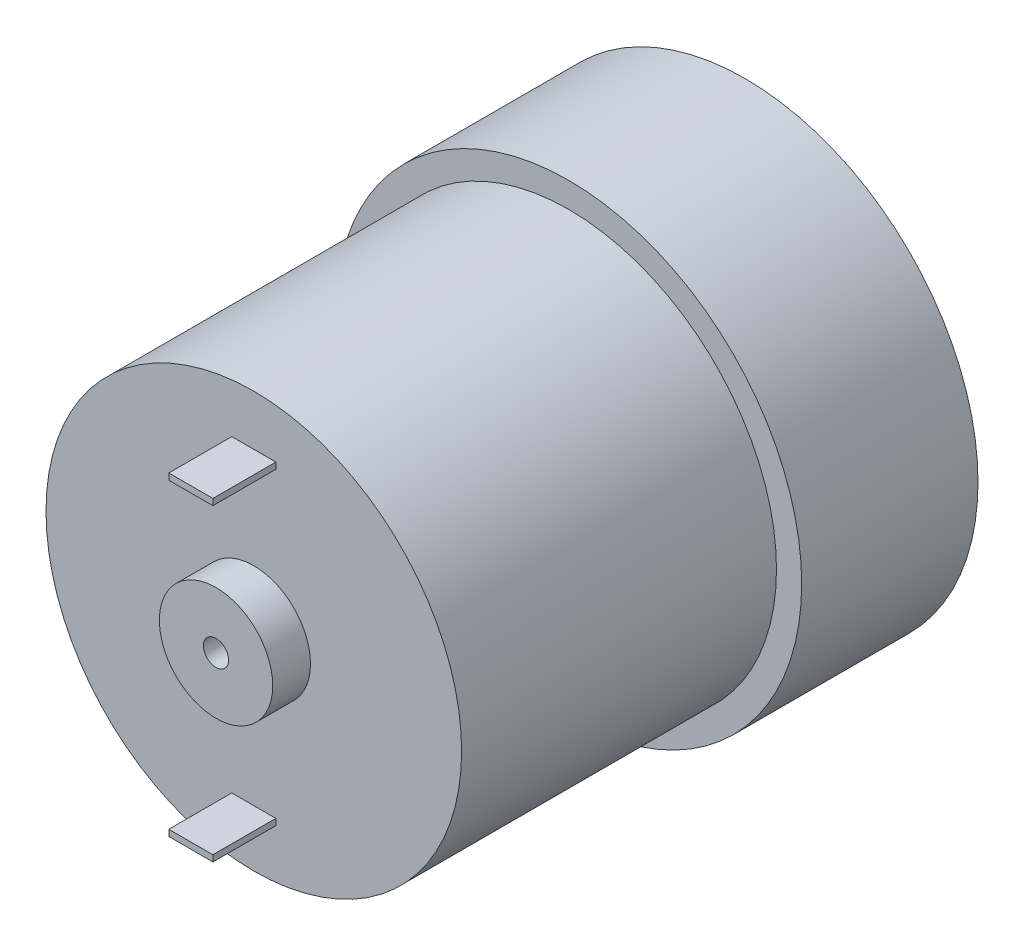
from build123d import *

# Parameters (mm, degrees)
SKETCH1_R                 = 18.5
BOSS_EXTRUDE1_DEPTH       = 42
CUT_EXTRUDE1_START        = -3
SKETCH2_R                 = 18.5
SKETCH2_R_2               = 4.5
CUT_EXTRUDE1_DEPTH        = 3
CUT_EXTRUDE4_START        = -25
SKETCH3_R                 = 18.5
SKETCH3_R_2               = 16.5
CUT_EXTRUDE4_DEPTH        = 25
SKETCH4_R                 = 6
BOSS_EXTRUDE2_DEPTH       = 4.6
FILLET1_R                 = 0.5
SKETCH5_R                 = 3
CUT_EXTRUDE5_DEPTH        = 10
SKETCH6_R                 = 1
CUT_EXTRUDE6_DEPTH        = 10
SKETCH7_W                 = 3.5
SKETCH7_H                 = 0.5
BOSS_EXTRUDE3_DEPTH       = 5
M3X0_5_TAPPED_HOLE1_D     = 2.5
M3X0_5_TAPPED_HOLE1_DEPTH = 7.5
M3X0_5_TAPPED_HOLE1_TIP   = 0.751075774
F_3_0MM_DOWEL_HOLE1_D     = 3
F_3_0MM_DOWEL_HOLE1_DEPTH = 7.5
F_3_0MM_DOWEL_HOLE1_TIP   = 0.901290929


with BuildPart() as part:
    # Sketch1 → Boss-Extrude1 (new body)
    with BuildSketch(Plane.XY):
        Circle(SKETCH1_R)
    extrude(amount=BOSS_EXTRUDE1_DEPTH)

    # Sketch2 → Cut-Extrude1 (cut)
    with BuildSketch(Plane.XY.offset(42).offset(CUT_EXTRUDE1_START)):
        Circle(SKETCH2_R)
        Circle(SKETCH2_R_2, mode=Mode.SUBTRACT)
    extrude(amount=CUT_EXTRUDE1_DEPTH, mode=Mode.SUBTRACT)

    # Sketch3 → Cut-Extrude4 (cut)
    with BuildSketch(Plane.XY.offset(39).offset(CUT_EXTRUDE4_START)):
        Circle(SKETCH3_R)
        Circle(SKETCH3_R_2, mode=Mode.SUBTRACT)
    extrude(amount=CUT_EXTRUDE4_DEPTH, mode=Mode.SUBTRACT)

    # Sketch4 → Boss-Extrude2 (add)
    with BuildSketch(Plane(origin=(0, 0, 0), x_dir=(-1, 0, 0), z_dir=(0, 0, -1))):
        with Locations((0, -7)):
            Circle(SKETCH4_R)
    extrude(amount=BOSS_EXTRUDE2_DEPTH)

    # Fillet1
    fillet1_edges = [part.edges().sort_by_distance(p)[0] for p in [
        (6, -7, -4.6),
    ]]
    fillet(fillet1_edges, radius=FILLET1_R)

    # Sketch5 → Cut-Extrude5 (cut)
    with BuildSketch(Plane(origin=(0, 0, -4.6), x_dir=(-1, 0, 0), z_dir=(0, 0, -1))):
        with Locations((0, -7)):
            Circle(SKETCH5_R)
    extrude(amount=-CUT_EXTRUDE5_DEPTH, mode=Mode.SUBTRACT)

    # Sketch6 → Cut-Extrude6 (cut)
    with BuildSketch(Plane.XY.offset(42)):
        Circle(SKETCH6_R)
    extrude(amount=-CUT_EXTRUDE6_DEPTH, mode=Mode.SUBTRACT)

    # Sketch7 → Boss-Extrude3 (add)
    with BuildSketch(Plane.XY.offset(39)):
        with Locations((0, 12.25)):
            Rectangle(SKETCH7_W, SKETCH7_H)
        with Locations((0, -12.25)):
            Rectangle(SKETCH7_W, SKETCH7_H)
    extrude(amount=BOSS_EXTRUDE3_DEPTH)

    # M3x0.5 Tapped Hole1
    with Locations(Plane(origin=(0, 0, 0), x_dir=(-1, 0, 0), z_dir=(0, 0, -1))):
        with Locations((-7.75, 13.423393759), (-13.829316686, -7), (13.829316686, -7), (-7.75, -13.423393759)):
            Hole(M3X0_5_TAPPED_HOLE1_D / 2, depth=M3X0_5_TAPPED_HOLE1_DEPTH)
            with Locations((0, 0, -(M3X0_5_TAPPED_HOLE1_DEPTH + M3X0_5_TAPPED_HOLE1_TIP / 2))):  # 118° drill point
                Cone(0, M3X0_5_TAPPED_HOLE1_D / 2, M3X0_5_TAPPED_HOLE1_TIP, mode=Mode.SUBTRACT)

    # Ø3.0mm Dowel Hole1
    with Locations(Plane(origin=(0, 0, 0), x_dir=(-1, 0, 0), z_dir=(0, 0, -1))):
        with Locations((-15.5, 0), (0, 15.5), (15.5, 0)):
            Hole(F_3_0MM_DOWEL_HOLE1_D / 2, depth=F_3_0MM_DOWEL_HOLE1_DEPTH)
            with Locations((0, 0, -(F_3_0MM_DOWEL_HOLE1_DEPTH + F_3_0MM_DOWEL_HOLE1_TIP / 2))):  # 118° drill point
                Cone(0, F_3_0MM_DOWEL_HOLE1_D / 2, F_3_0MM_DOWEL_HOLE1_TIP, mode=Mode.SUBTRACT)


solid = part.part
